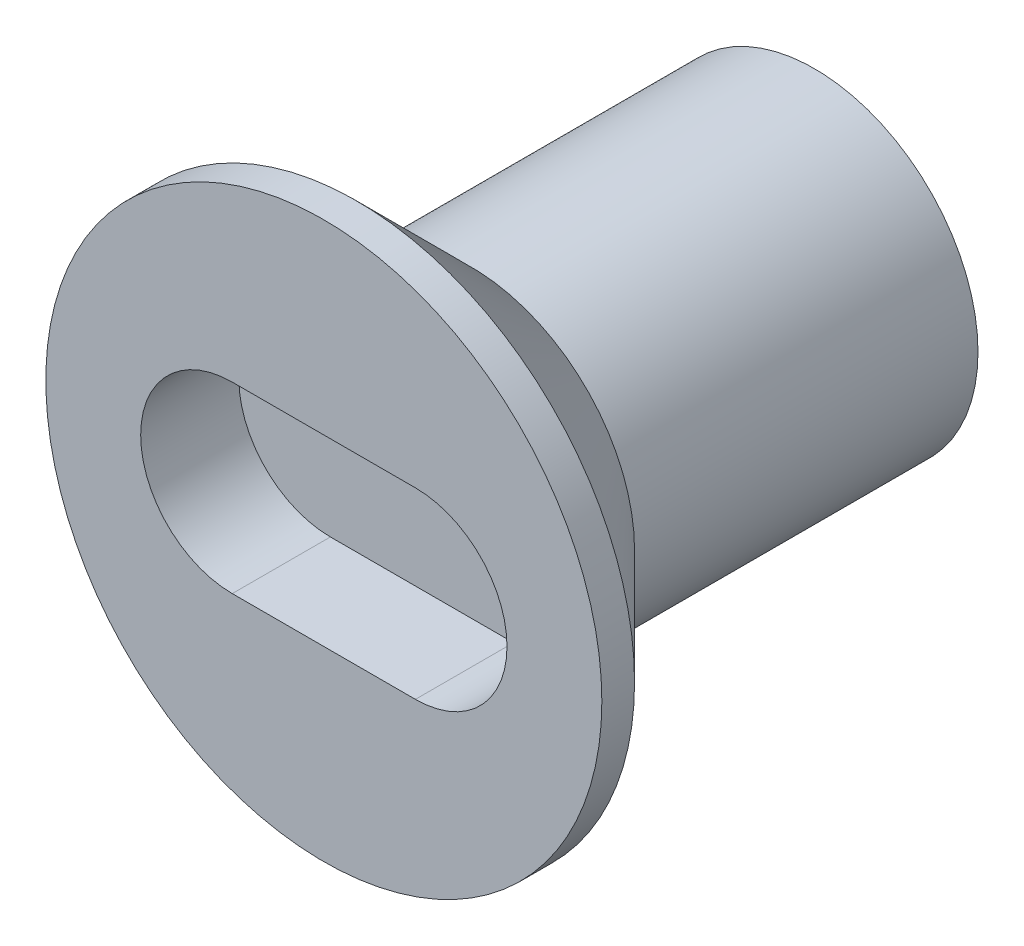
from build123d import *

# Parameters (mm, degrees)
SKETCH1_R           = 5
BOSS_EXTRUDE1_DEPTH = 10
SKETCH2_R           = 8.5
BOSS_EXTRUDE2_DEPTH = 5
CUT_EXTRUDE1_DEPTH  = 3
CHAMFER1_SIZE       = 4


with BuildPart() as part:
    # Sketch1 → Boss-Extrude1 (new body)
    with BuildSketch(Plane.XY):
        Circle(SKETCH1_R)
    extrude(amount=BOSS_EXTRUDE1_DEPTH)

    # Sketch2 → Boss-Extrude2 (add)
    with BuildSketch(Plane.XY.offset(10)):
        Circle(SKETCH2_R)
    extrude(amount=BOSS_EXTRUDE2_DEPTH)

    # Sketch3 → Cut-Extrude1 (cut)
    with BuildSketch(Plane.XY.offset(15)):
        with BuildLine():
            Line((-2.8, 2.8), (2.8, 2.8))
            ThreePointArc((2.8, 2.8), (5.6, 0), (2.8, -2.8))
            Line((2.8, -2.8), (-2.8, -2.8))
            ThreePointArc((-2.8, -2.8), (-5.6, 0), (-2.8, 2.8))
        make_face()
    extrude(amount=-CUT_EXTRUDE1_DEPTH, mode=Mode.SUBTRACT)

    # Chamfer1
    # the kernel refuses this chamfer: 4 mm, written as the material it takes off along each edge
    with BuildSketch(Plane(origin=(0, 0, 10), x_dir=(1, 0, 0), z_dir=(0, -1, 0))) as chamfer1_piece_1_section:
        Polygon((8.5, CHAMFER1_SIZE), (8.5 - CHAMFER1_SIZE, 0), (8.5, 0), align=None)
    chamfer1_piece_1 = revolve(axis=Axis((0, 0, 10), (0, 0, 1)), mode=Mode.PRIVATE)
    chamfer1_piece_1 = chamfer1_piece_1 - Plane(origin=(0, 0, 12.254882924), x_dir=(1, 0, 0), z_dir=(0, 0, -1)) * Cylinder(5, 34, mode=Mode.PRIVATE)
    add(chamfer1_piece_1, mode=Mode.SUBTRACT)


solid = part.part
